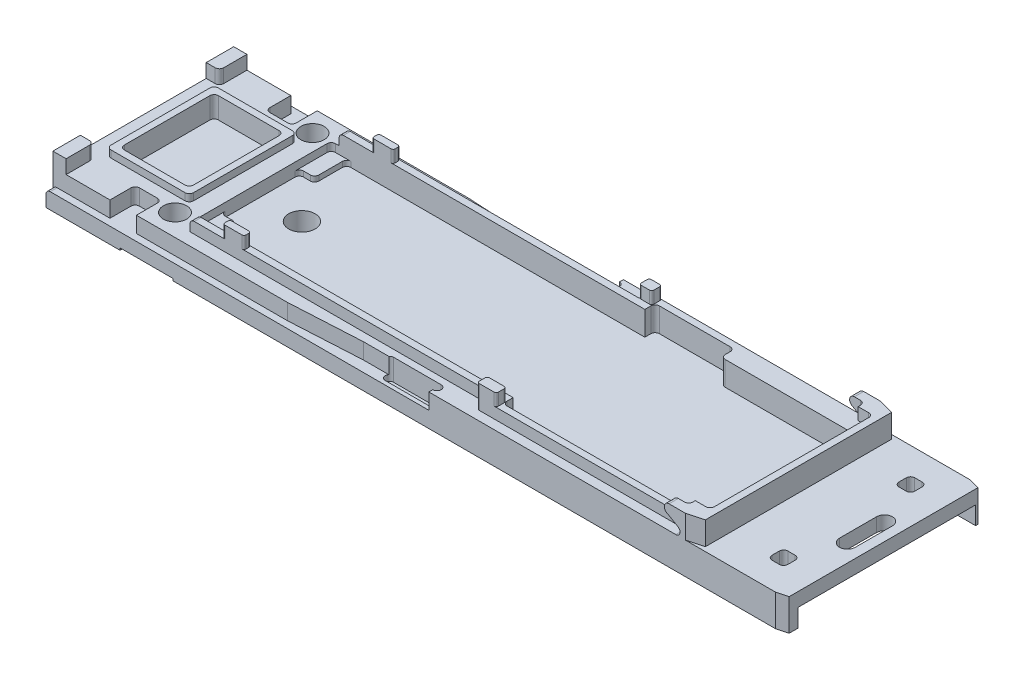
from build123d import *
from OCP.BRepFilletAPI import BRepFilletAPI_MakeChamfer

# Parameters (mm, degrees)
SKETCH1_W                                    = 70
SKETCH1_H                                    = 18.4
BOSS_EXTRUDE1_DEPTH                          = 4.05
CUT_EXTRUDE1_DEPTH                           = 2.28
SKETCH5_W                                    = 6.55
SKETCH5_H                                    = 8.9
CUT_EXTRUDE2_DEPTH                           = 2.38
SKETCH17_W                                   = 70
SKETCH17_H                                   = 18.4
CUT_EXTRUDE8_DEPTH                           = 1.05
SKETCH18_W                                   = 7.8
SKETCH18_H                                   = 10.15
SKETCH18_W_2                                 = 6.55
SKETCH18_H_2                                 = 8.9
BOSS_EXTRUDE3_DEPTH                          = 3.67
CSK_FOR_M2_COUNTERSUNK_FLAT_HEAD_SCR_2_COUNT = 2
CSK_FOR_M2_COUNTERSUNK_FLAT_HEAD_SCR_2_PITCH = 13
CUT_EXTRUDE5_DEPTH                           = 2.55
SKETCH19_W                                   = 1.25
SKETCH19_H                                   = 2.6
BOSS_EXTRUDE4_DEPTH                          = 4.3
SKETCH20_W                                   = 2.5
SKETCH20_H                                   = 2.385
CUT_EXTRUDE9_DEPTH                           = 1.5
SKETCH21_W                                   = 2
SKETCH21_H                                   = 0.65
BOSS_EXTRUDE5_DEPTH                          = 5.2
BOSS_EXTRUDE6_DEPTH                          = 5.2
CHAMFER2_SIZE                                = 1.5
CHAMFER2_SIZE2                               = 0.401923789
CHAMFER1_SIZE                                = 1
CHAMFER1_SIZE2                               = 0.267949192
CUT_EXTRUDE10_DEPTH                          = 37.313083042
CUT_EXTRUDE7_DEPTH                           = 0.2
CHAMFER2_OF_MIRROR1_SIZE2                    = 1.5
CHAMFER2_OF_MIRROR1_SIZE                     = 0.401923789
CUT_EXTRUDE12_DEPTH                          = 0.875
CUT_EXTRUDE13_START                          = -0.875
CUT_EXTRUDE13_DEPTH                          = 0.875
SKETCH26_W                                   = 1.8
SKETCH26_H                                   = 0.95
SKETCH26_W_2                                 = 1.18
BOSS_EXTRUDE8_DEPTH                          = 5.2
FILLET1_R                                    = 0.4
FILLET2_R                                    = 0.2
SKETCH23_W                                   = 0.65
SKETCH23_H                                   = 15.4
BOSS_EXTRUDE7_DEPTH                          = 1.15
SKETCH27_W                                   = 13.1
SKETCH27_H                                   = 1.275
BOSS_EXTRUDE9_DEPTH                          = 2.28
FILLET3_R                                    = 0.4
CUT_EXTRUDE11_DEPTH                          = 1.7
SKETCH31_W                                   = 1.45
SKETCH31_H                                   = 3.025
BOSS_EXTRUDE10_DEPTH                         = 0.5
SKETCH32_W                                   = 4.5
SKETCH32_H                                   = 0.65
CUT_EXTRUDE14_DEPTH                          = 0.55
CUT_EXTRUDE15_DEPTH                          = 37.43765223
FILLET5_R                                    = 0.4
FILLET6_R                                    = 0.4
FILLET7_R                                    = 0.4
FILLET8_R                                    = 0.4
CUT_EXTRUDE16_DEPTH                          = 37.313083042
SKETCH35_R                                   = 1.25
CUT_EXTRUDE17_DEPTH                          = 37.351133407


with BuildPart() as part:
    # Sketch1 → Boss-Extrude1 (new body)
    with BuildSketch(Plane(origin=(0, 0, 0), x_dir=(1, 0, 0), z_dir=(0, 1, 0))):
        Rectangle(SKETCH1_W, SKETCH1_H)
    extrude(amount=BOSS_EXTRUDE1_DEPTH)

    # Sketch2 → Cut-Extrude1 (cut)
    with BuildSketch(Plane(origin=(0, 4.05, 0), x_dir=(1, 0, 0), z_dir=(0, 1, 0))):
        Polygon((-23.95, 6.725), (-23.95, -6.725), (6.7, -6.725), (6.7, -7.7), (26.3, -7.7), (26.3, 7.7), (5.7, 7.7), (5.7, 6.725), align=None)
    extrude(amount=-CUT_EXTRUDE1_DEPTH, mode=Mode.SUBTRACT)

    # Sketch5 → Cut-Extrude2 (cut)
    with BuildSketch(Plane(origin=(0, 4.05, 0), x_dir=(1, 0, 0), z_dir=(0, 1, 0))):
        with Locations((-29.475, 0)):
            Rectangle(SKETCH5_W, SKETCH5_H)
    extrude(amount=-CUT_EXTRUDE2_DEPTH, mode=Mode.SUBTRACT)

    # Sketch17 → Cut-Extrude8 (cut)
    with BuildSketch(Plane(origin=(0, 4.05, 0), x_dir=(1, 0, 0), z_dir=(0, 1, 0))):
        Rectangle(SKETCH17_W, SKETCH17_H)
        Polygon((-23.2, 7.375), (-23.2, -7.375), (5.05, -7.375), (5.05, -8.325), (26.95, -8.325), (26.95, 8.325), (5.05, 8.325), (5.05, 7.375), align=None, mode=Mode.SUBTRACT)
    extrude(amount=-CUT_EXTRUDE8_DEPTH, mode=Mode.SUBTRACT)

    # Sketch18 → Boss-Extrude3 (add)
    with BuildSketch(Plane(origin=(0, 0, 0), x_dir=(1, 0, 0), z_dir=(0, 1, 0))):
        with Locations((-29.475, 0)):
            Rectangle(SKETCH18_W, SKETCH18_H)
        with Locations((-29.475, 0)):
            Rectangle(SKETCH18_W_2, SKETCH18_H_2, mode=Mode.SUBTRACT)
    extrude(amount=BOSS_EXTRUDE3_DEPTH)

    # Sketch6 → CSK for M2 Countersunk Flat Head Screw1 (revolve, cut)
    with BuildSketch(Plane(origin=(-25.5, 0, -6.5), x_dir=(0, 0, -1), z_dir=(1, 0, 0))):
        Polygon((0, 0), (0, 4.05), (1.1, 4.05), (1.1, 1.3), (2.2, 0.2), (2.2, 0), align=None)
    csk_for_m2_countersunk_flat_head_screw1 = revolve(axis=Axis((-25.5, -6.35, -6.5), (0, 1, 0)), mode=Mode.SUBTRACT)

    # CSK for M2 Countersunk Flat Head Scr 2: CSK for M2 Countersunk Flat Head Screw1 ×2
    with Locations(*[(0, 0, i * CSK_FOR_M2_COUNTERSUNK_FLAT_HEAD_SCR_2_PITCH) for i in range(1, CSK_FOR_M2_COUNTERSUNK_FLAT_HEAD_SCR_2_COUNT)]):
        add(csk_for_m2_countersunk_flat_head_screw1, mode=Mode.SUBTRACT)

    # Sketch13 → Cut-Extrude5 (cut)
    with BuildSketch(Plane(origin=(0, 4.05, 0), x_dir=(1, 0, 0), z_dir=(0, 1, 0))):
        Polygon((-35, 9.2), (1.2, 9.2), (1.2, 8.175), (-6, 8.175), (-12.8, 8.55), (-35, 8.55), align=None)
    cut_extrude5 = extrude(amount=-CUT_EXTRUDE5_DEPTH, mode=Mode.SUBTRACT)

    # Sketch19 → Boss-Extrude4 (add)
    with BuildSketch(Plane(origin=(0, 0, 0), x_dir=(1, 0, 0), z_dir=(0, 1, 0))):
        with Locations((-34.375, 7.25)):
            Rectangle(SKETCH19_W, SKETCH19_H)
    boss_extrude4 = extrude(amount=BOSS_EXTRUDE4_DEPTH)

    # Sketch20 → Cut-Extrude9 (cut)
    with BuildSketch(Plane(origin=(0, 3, 0), x_dir=(1, 0, 0), z_dir=(0, 1, 0))):
        with Locations((-28.35, 7.3575)):
            Rectangle(SKETCH20_W, SKETCH20_H)
    cut_extrude9 = extrude(amount=-CUT_EXTRUDE9_DEPTH, mode=Mode.SUBTRACT)

    # Sketch21 → Boss-Extrude5 (add)
    with BuildSketch(Plane(origin=(0, 0, 0), x_dir=(1, 0, 0), z_dir=(0, 1, 0))):
        with Locations((-19.1, 7.05)):
            Rectangle(SKETCH21_W, SKETCH21_H)
    boss_extrude5 = extrude(amount=BOSS_EXTRUDE5_DEPTH)

    # Sketch22 → Boss-Extrude6 (add)
    with BuildSketch(Plane.XZ):
        Polygon((24.9, -7.7), (26.95, -7.7), (26.95, -9.2), (22.15, -9.2), (22.15, -8.325), (24.9, -8.325), align=None)
    boss_extrude6 = extrude(amount=-BOSS_EXTRUDE6_DEPTH)

    # Chamfer2
    chamfer2_edges = [part.edges().sort_by_distance(p)[0] for p in [
        (26.95, 4.1, -9.2),
    ]]
    chamfer2_side = [part.faces().sort_by_distance(p)[0] for p in [
        (7.078780224, 1.420191267, -9.2),
    ]]
    chamfer(chamfer2_edges, length=CHAMFER2_SIZE, length2=CHAMFER2_SIZE2, reference=chamfer2_side[0])

    # Chamfer1: one chamfer whose edges measure the first distance from different faces: ONE call of the kernel's chamfer builder (chamfer() names one face for all edges)
    chamfer1_edges_1 = [part.edges().sort_by_distance(p)[0] for p in [
        (35, 1.5, 9.2),
    ]]
    chamfer1_side_1 = [part.faces().sort_by_distance(p)[0] for p in [
        (0, 1.5, 9.2),
    ]]
    chamfer1_edges_2 = [part.edges().sort_by_distance(p)[0] for p in [
        (35, 1.5, -9.2),
    ]]
    chamfer1_side_2 = [part.faces().sort_by_distance(p)[0] for p in [
        (6.691568483, 1.365924153, -9.2),
    ]]
    chamfer1 = BRepFilletAPI_MakeChamfer(part.part.solid().wrapped)
    for e in chamfer1_edges_1:
        chamfer1.Add(CHAMFER1_SIZE, CHAMFER1_SIZE2, e.wrapped, chamfer1_side_1[0].wrapped)  # the first distance lies on this face
    for e in chamfer1_edges_2:
        chamfer1.Add(CHAMFER1_SIZE, CHAMFER1_SIZE2, e.wrapped, chamfer1_side_2[0].wrapped)  # the first distance lies on this face
    add(Compound.cast(chamfer1.Shape()), mode=Mode.REPLACE)

    # Sketch25 → Cut-Extrude10 (cut, through all)
    with BuildSketch(Plane(origin=(0, 3, 0), x_dir=(1, 0, 0), z_dir=(0, 1, 0))):
        with BuildLine():
            Line((31.2, 6.75), (31.9, 6.75))
            ThreePointArc((31.9, 6.75), (32.182842712, 6.632842712), (32.3, 6.35))
            Line((32.3, 6.35), (32.3, 5.65))
            ThreePointArc((32.3, 5.65), (32.182842712, 5.367157288), (31.9, 5.25))
            Line((31.9, 5.25), (31.2, 5.25))
            ThreePointArc((31.2, 5.25), (30.917157288, 5.367157288), (30.8, 5.65))
            Line((30.8, 5.65), (30.8, 6.35))
            ThreePointArc((30.8, 6.35), (30.917157288, 6.632842712), (31.2, 6.75))
        make_face()
    cut_extrude10 = extrude(amount=-CUT_EXTRUDE10_DEPTH, mode=Mode.SUBTRACT)

    # Sketch16 → Cut-Extrude7 (cut)
    with BuildSketch(Plane.XZ):
        with BuildLine():
            Line((-28, -9.2), (-28, -6.5))
            ThreePointArc((-28, -6.5), (-25.5, -4), (-23, -6.5))
            Line((-23, -6.5), (-23, -9.2))
            Line((-23, -9.2), (-28, -9.2))
        make_face()
    cut_extrude7 = extrude(amount=-CUT_EXTRUDE7_DEPTH, mode=Mode.SUBTRACT)

    # Mirror1: Cut-Extrude5, Boss-Extrude4, Cut-Extrude9, Boss-Extrude5, Boss-Extrude6, Cut-Extrude10, Cut-Extrude7 across plane
    add(cut_extrude5.mirror(Plane.XY), mode=Mode.SUBTRACT)
    add(boss_extrude4.mirror(Plane.XY))
    add(cut_extrude9.mirror(Plane.XY), mode=Mode.SUBTRACT)
    add(boss_extrude5.mirror(Plane.XY))
    add(boss_extrude6.mirror(Plane.XY))
    add(cut_extrude10.mirror(Plane.XY), mode=Mode.SUBTRACT)
    add(cut_extrude7.mirror(Plane.XY), mode=Mode.SUBTRACT)

    # Chamfer2 of Mirror1
    chamfer2_of_mirror1_edges = [part.edges().sort_by_distance(p)[0] for p in [
        (26.95, 4.1, 9.2),
    ]]
    chamfer(chamfer2_of_mirror1_edges, length=CHAMFER2_OF_MIRROR1_SIZE, length2=CHAMFER2_OF_MIRROR1_SIZE2)

    # Sketch29 → Cut-Extrude12 (cut)
    with BuildSketch(Plane.XY.offset(-9.2)):
        with BuildLine():
            Line((23.693911087, 4.360288568), (24.757179677, 3.746410162))
            ThreePointArc((24.757179677, 3.746410162), (24.943550007, 3.296472382), (24.557179677, 3))
            Line((24.557179677, 3), (21.557179677, 3))
            Line((21.557179677, 3), (21.557179677, 5.2))
            Line((21.557179677, 5.2), (23.918911087, 5.2))
            ThreePointArc((23.918911087, 5.2), (23.484244465, 4.86646857), (23.693911087, 4.360288568))
        make_face()
    extrude(amount=CUT_EXTRUDE12_DEPTH, mode=Mode.SUBTRACT)

    # Sketch30 → Cut-Extrude13 (cut)
    with BuildSketch(Plane.XY.offset(9.2).offset(CUT_EXTRUDE13_START)):
        with BuildLine():
            Line((23.693911087, 4.360288568), (24.757179677, 3.746410162))
            ThreePointArc((24.757179677, 3.746410162), (24.943550007, 3.296472382), (24.557179677, 3))
            Line((24.557179677, 3), (21.557179677, 3))
            Line((21.557179677, 3), (21.557179677, 5.2))
            Line((21.557179677, 5.2), (23.918911087, 5.2))
            ThreePointArc((23.918911087, 5.2), (23.484244465, 4.86646857), (23.693911087, 4.360288568))
        make_face()
    extrude(amount=CUT_EXTRUDE13_DEPTH, mode=Mode.SUBTRACT)

    # Sketch26 → Boss-Extrude8 (add)
    with BuildSketch(Plane.XZ):
        with Locations((5.8, 7.85)):
            Rectangle(SKETCH26_W, SKETCH26_H)
        with Locations((5.11, -7.85)):
            Rectangle(SKETCH26_W_2, SKETCH26_H)
    extrude(amount=-BOSS_EXTRUDE8_DEPTH)

    # Fillet1
    fillet1_edges = [part.edges().sort_by_distance(p)[0] for p in [
        (-23.2, 4.05, -7.05),
        (-23.2, 4.05, 7.05),
    ]]
    fillet(fillet1_edges, radius=FILLET1_R)

    # Fillet2
    fillet2_edges = [part.edges().sort_by_distance(p)[0] for p in [
        (-20.1, 4.625, -7.375),
        (-20.1, 4.625, -6.725),
        (-18.1, 4.625, -6.725),
        (-18.1, 4.625, -7.375),
        (-20.1, 4.625, 6.725),
        (-20.1, 4.625, 7.375),
        (-18.1, 4.625, 7.375),
        (-18.1, 4.625, 6.725),
        (4.9, 4.1, 8.325),
        (6.7, 4.625, 7.375),
        (6.7, 4.625, 8.325),
        (4.9, 4.625, 7.375),
        (5.7, 4.625, -7.375),
        (5.7, 4.625, -8.325),
        (4.52, 4.1, -8.325),
        (4.52, 4.625, -7.375),
    ]]
    fillet(fillet2_edges, radius=FILLET2_R)

    # Sketch23 → Boss-Extrude7 (add)
    with BuildSketch(Plane(origin=(0, 4.05, 0), x_dir=(1, 0, 0), z_dir=(0, 1, 0))):
        with Locations((26.625, 0)):
            Rectangle(SKETCH23_W, SKETCH23_H)
    extrude(amount=BOSS_EXTRUDE7_DEPTH)

    # Sketch27 → Boss-Extrude9 (add)
    with BuildSketch(Plane(origin=(0, 1.77, 0), x_dir=(1, 0, 0), z_dir=(0, 1, 0))):
        with Locations((19.75, 7.0625)):
            Rectangle(SKETCH27_W, SKETCH27_H)
    extrude(amount=BOSS_EXTRUDE9_DEPTH)

    # Fillet3
    fillet3_edges = [part.edges().sort_by_distance(p)[0] for p in [
        (13.2, 2.91, -7.7),
        (13.2, 2.91, -6.425),
    ]]
    fillet(fillet3_edges, radius=FILLET3_R)

    # Sketch28 → Cut-Extrude11 (cut)
    with BuildSketch(Plane.XZ):
        Polygon((35, 8.1), (30.8, 8.1), (30.8, -7), (14.2, -7), (14.2, -8.7), (35, -8.7), align=None)
    extrude(amount=-CUT_EXTRUDE11_DEPTH, mode=Mode.SUBTRACT)

    # Sketch31 → Boss-Extrude10 (add)
    with BuildSketch(Plane(origin=(0, 1.77, 0), x_dir=(1, 0, 0), z_dir=(0, 1, 0))):
        with Locations((-23.225, 5.2125)):
            Rectangle(SKETCH31_W, SKETCH31_H)
        with Locations((-23.225, -5.2125)):
            Rectangle(SKETCH31_W, SKETCH31_H)
    extrude(amount=BOSS_EXTRUDE10_DEPTH)

    # Sketch32 → Cut-Extrude14 (cut)
    with BuildSketch(Plane(origin=(0, 1.5, 0), x_dir=(1, 0, 0), z_dir=(0, 1, 0))):
        with Locations((-1.05, 8.5)):
            Rectangle(SKETCH32_W, SKETCH32_H)
        with Locations((-1.05, -8.5)):
            Rectangle(SKETCH32_W, SKETCH32_H)
    extrude(amount=-CUT_EXTRUDE14_DEPTH, mode=Mode.SUBTRACT)

    # Sketch33 → Cut-Extrude15 (cut, through all)
    with BuildSketch(Plane(origin=(0, 0.95, 0), x_dir=(1, 0, 0), z_dir=(0, 1, 0))):
        with BuildLine():
            Line((-3.3, -8.825), (1.2, -8.825))
            ThreePointArc((1.2, -8.825), (1.6, -8.425), (1.2, -8.025))
            Line((1.2, -8.025), (-3.3, -8.025))
            ThreePointArc((-3.3, -8.025), (-3.7, -8.425), (-3.3, -8.825))
        make_face()
    cut_extrude15 = extrude(amount=CUT_EXTRUDE15_DEPTH, mode=Mode.SUBTRACT)

    # Mirror2: Cut-Extrude15 across plane
    add(cut_extrude15.mirror(Plane.XY), mode=Mode.SUBTRACT)

    # Fillet5
    # the kernel refuses this fillet: 0.4 mm, written as the material it adds along each edge
    with BuildSketch(Plane(origin=(5.7, 4.05, -7.7), x_dir=(0, 0, 1), z_dir=(0, -1, 0)), Plane(origin=(6.7, 4.05, 7.7), x_dir=(1, 0, 0), z_dir=(0, -1, 0))) as fillet5_piece_1:
        with BuildLine():
            CenterArc((FILLET5_R, -FILLET5_R), FILLET5_R, 90, 90)
            Line((0, -FILLET5_R), (0, 0))
            Line((0, 0), (FILLET5_R, 0))
        make_face()
    extrude(amount=3.28)
    with BuildSketch(Plane(origin=(26.3, 5.2, 7.7), x_dir=(0, 0, -1), z_dir=(0, -1, 0))) as fillet5_piece_2:
        with BuildLine():
            CenterArc((FILLET5_R, -FILLET5_R), FILLET5_R, 90, 90)
            Line((0, -FILLET5_R), (0, 0))
            Line((0, 0), (FILLET5_R, 0))
        make_face()
    extrude(amount=4.43)
    with BuildSketch(Plane(origin=(-29.6, 3, -6.165), x_dir=(1, 0, 0), z_dir=(0, -1, 0)), Plane(origin=(-29.6, 3, 6.165), x_dir=(0, 0, 1), z_dir=(0, -1, 0))) as fillet5_piece_3:
        with BuildLine():
            CenterArc((FILLET5_R, -FILLET5_R), FILLET5_R, 90, 90)
            Line((0, -FILLET5_R), (0, 0))
            Line((0, 0), (FILLET5_R, 0))
        make_face()
    extrude(amount=2.5)
    with BuildSketch(Plane(origin=(-27.1, 3, -6.165), x_dir=(0, 0, -1), z_dir=(0, -1, 0)), Plane(origin=(-27.1, 3, 6.165), x_dir=(-1, 0, 0), z_dir=(0, -1, 0))) as fillet5_piece_4:
        with BuildLine():
            CenterArc((FILLET5_R, -FILLET5_R), FILLET5_R, 90, 90)
            Line((0, -FILLET5_R), (0, 0))
            Line((0, 0), (FILLET5_R, 0))
        make_face()
    extrude(amount=1.5)
    with BuildSketch(Plane(origin=(24.9, 3.05, -8.325), x_dir=(0, 0, 1), z_dir=(0, 1, 0))) as fillet5_piece_5:
        with BuildLine():
            CenterArc((FILLET5_R, -FILLET5_R), FILLET5_R, 90, 90)
            Line((0, -FILLET5_R), (0, 0))
            Line((0, 0), (FILLET5_R, 0))
        make_face()
    extrude(amount=2.15)
    with BuildSketch(Plane(origin=(-26.2, 0.67, -4.45), x_dir=(-1, 0, 0), z_dir=(0, 1, 0)), Plane(origin=(-26.2, 0.67, 4.45), x_dir=(0, 0, -1), z_dir=(0, 1, 0)), Plane(origin=(-32.75, 0.67, 4.45), x_dir=(1, 0, 0), z_dir=(0, 1, 0)), Plane(origin=(-32.75, 3.67, -4.45), x_dir=(1, 0, 0), z_dir=(0, -1, 0))) as fillet5_piece_6:
        with BuildLine():
            CenterArc((FILLET5_R, FILLET5_R), FILLET5_R, 180, 90)
            Line((0, FILLET5_R), (0, 0))
            Line((0, 0), (FILLET5_R, 0))
        make_face()
    extrude(amount=3)
    with BuildSketch(Plane(origin=(24.9, 3.05, 8.325), x_dir=(0, 0, -1), z_dir=(0, 1, 0)), Plane(origin=(26.3, 5.2, -7.7), x_dir=(0, 0, 1), z_dir=(0, -1, 0))) as fillet5_piece_7:
        with BuildLine():
            CenterArc((FILLET5_R, FILLET5_R), FILLET5_R, 180, 90)
            Line((0, FILLET5_R), (0, 0))
            Line((0, 0), (FILLET5_R, 0))
        make_face()
    extrude(amount=2.15)
    with BuildSketch(Plane(origin=(26.3, 0.77, -6.425), x_dir=(-1, 0, 0), z_dir=(0, 1, 0))) as fillet5_piece_8:
        with BuildLine():
            CenterArc((FILLET5_R, FILLET5_R), FILLET5_R, 180, 90)
            Line((0, FILLET5_R), (0, 0))
            Line((0, 0), (FILLET5_R, 0))
        make_face()
    extrude(amount=3.28)
    with BuildSketch(Plane(origin=(14.2, 0, -8.7), x_dir=(1, 0, 0), z_dir=(0, 1, 0)), Plane(origin=(14.2, 0, -7), x_dir=(0, 0, -1), z_dir=(0, 1, 0)), Plane(origin=(30.8, 0, 8.1), x_dir=(0, 0, -1), z_dir=(0, 1, 0))) as fillet5_piece_9:
        with BuildLine():
            CenterArc((FILLET5_R, -FILLET5_R), FILLET5_R, 90, 90)
            Line((0, -FILLET5_R), (0, 0))
            Line((0, 0), (FILLET5_R, 0))
        make_face()
    extrude(amount=2.7)
    with BuildSketch(Plane(origin=(-23.95, 3, -6.725), x_dir=(0, 0, 1), z_dir=(0, -1, 0)), Plane(origin=(-23.95, 3, 6.725), x_dir=(1, 0, 0), z_dir=(0, -1, 0))) as fillet5_piece_10:
        with BuildLine():
            CenterArc((FILLET5_R, -FILLET5_R), FILLET5_R, 90, 90)
            Line((0, -FILLET5_R), (0, 0))
            Line((0, 0), (FILLET5_R, 0))
        make_face()
    extrude(amount=1.73)
    with BuildSketch(Plane(origin=(-23.95, 0.77, -3.7), x_dir=(0, 0, 1), z_dir=(0, 1, 0)), Plane(origin=(-22.5, 0.77, -6.725), x_dir=(0, 0, 1), z_dir=(0, 1, 0)), Plane(origin=(-23.95, 0.77, 3.7), x_dir=(1, 0, 0), z_dir=(0, 1, 0)), Plane(origin=(-22.5, 0.77, 6.725), x_dir=(1, 0, 0), z_dir=(0, 1, 0))) as fillet5_piece_11:
        with BuildLine():
            CenterArc((FILLET5_R, FILLET5_R), FILLET5_R, 180, 90)
            Line((0, FILLET5_R), (0, 0))
            Line((0, 0), (FILLET5_R, 0))
        make_face()
    extrude(amount=1.5)

    # Fillet6
    fillet6_edges = [part.edges().sort_by_distance(p)[0] for p in [
        (-22.5, 2.02, -3.7),
        (-22.5, 2.02, 3.7),
    ]]
    fillet(fillet6_edges, radius=FILLET6_R)

    # Fillet7
    fillet7_edges = [part.edges().sort_by_distance(p)[0] for p in [
        (-35, 1.5, -8.875),
        (-35, 1.5, 8.875),
    ]]
    fillet(fillet7_edges, radius=FILLET7_R)

    # Fillet8
    fillet8_edges = [part.edges().sort_by_distance(p)[0] for p in [
        (-25.575, 3.335, -5.075),
        (-33.375, 3.335, -5.075),
        (-33.375, 3.335, 5.075),
        (-25.575, 3.335, 5.075),
        (-33.75, 3.65, -5.95),
        (-33.75, 3.65, 5.95),
    ]]
    fillet(fillet8_edges, radius=FILLET8_R)

    # Sketch34 → Cut-Extrude16 (cut, through all)
    with BuildSketch(Plane(origin=(0, 3, 0), x_dir=(1, 0, 0), z_dir=(0, 1, 0))):
        with BuildLine():
            Line((32.588181399, -1.75), (32.588181399, 1.75))
            ThreePointArc((32.588181399, 1.75), (33.338181399, 2.5), (34.088181399, 1.75))
            Line((34.088181399, 1.75), (34.088181399, -1.75))
            ThreePointArc((34.088181399, -1.75), (33.338181399, -2.5), (32.588181399, -1.75))
        make_face()
    extrude(amount=-CUT_EXTRUDE16_DEPTH, mode=Mode.SUBTRACT)

    # Sketch35 → Cut-Extrude17 (cut, through all)
    with BuildSketch(Plane(origin=(0, 1.77, 0), x_dir=(1, 0, 0), z_dir=(0, 1, 0))):
        with Locations(Location((-20, 0, 0), (0, 0, 270))):
            Circle(SKETCH35_R)
    extrude(amount=-CUT_EXTRUDE17_DEPTH, mode=Mode.SUBTRACT)


solid = part.part
